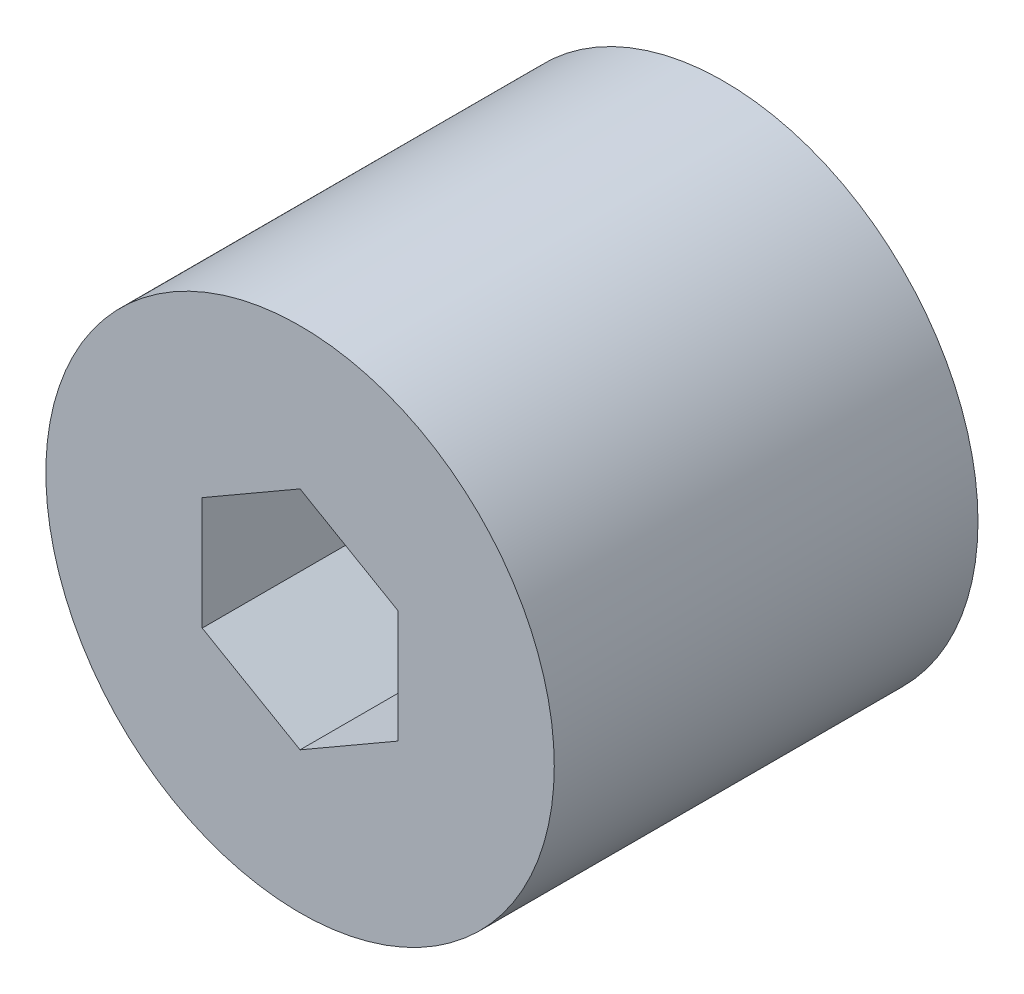
from build123d import *

# Parameters (mm, degrees)
SCHIZZO1_R                   = 4.5
ESTRUSIONE_ESTRUSIONE1_DEPTH = 7.5
TAGLIO_ESTRUSIONE1_DEPTH     = 7.5


with BuildPart() as part:
    # Schizzo1 → Estrusione-Estrusione1 (new body)
    with BuildSketch(Plane.XY):
        with Locations((-6.404870735, 0)):
            Circle(SCHIZZO1_R)
    extrude(amount=ESTRUSIONE_ESTRUSIONE1_DEPTH)

    # Schizzo3 → Taglio-Estrusione1 (cut)
    with BuildSketch(Plane.XY.offset(7.5)):
        Polygon((-6.404870735, 2), (-8.136921542, 1), (-8.136921542, -1), (-6.404870735, -2), (-4.672819927, -1), (-4.672819927, 1), align=None)
    extrude(amount=-TAGLIO_ESTRUSIONE1_DEPTH, mode=Mode.SUBTRACT)


solid = part.part
